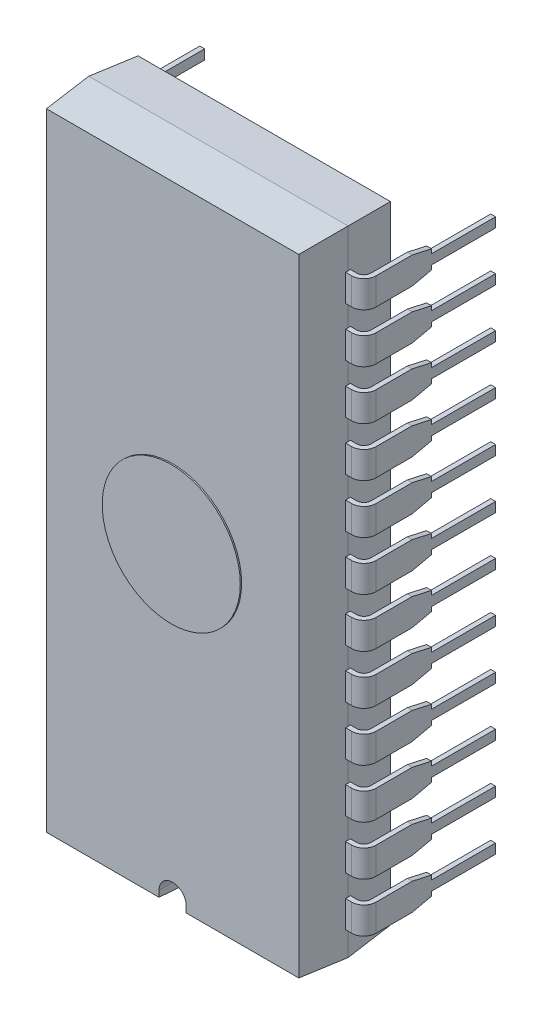
from build123d import *

# Parameters (mm, degrees)
BASIC_SHAPE_DEPTH               = 16.32
SIDE_PROFILE1_DEPTH             = 19.538694668
SIDE_PROFILE1_DEPTH_BACK        = 19.538694668
SIDE_PROFILE2_DEPTH             = 19.538694668
SIDE_PROFILE2_DEPTH_BACK        = 19.538694668
SKETCH6_W                       = 0.25
SKETCH6_H                       = 1.39
PIN_RELIEF_DEPTH                = 23.280195331
REMAINING_PINS_COUNT            = 12
REMAINING_PINS_PITCH            = 2.54
REMAINING_PINS_COPY_1_SKETCH_W  = 0.25
REMAINING_PINS_COPY_1_SKETCH_H  = 1.39
REMAINING_PINS_COPY_2_SKETCH_W  = 0.25
REMAINING_PINS_COPY_2_SKETCH_H  = 1.39
REMAINING_PINS_COPY_3_SKETCH_W  = 0.25
REMAINING_PINS_COPY_3_SKETCH_H  = 1.39
REMAINING_PINS_COPY_4_SKETCH_W  = 0.25
REMAINING_PINS_COPY_4_SKETCH_H  = 1.39
REMAINING_PINS_COPY_5_SKETCH_W  = 0.25
REMAINING_PINS_COPY_5_SKETCH_H  = 1.39
REMAINING_PINS_COPY_6_SKETCH_W  = 0.25
REMAINING_PINS_COPY_6_SKETCH_H  = 1.39
REMAINING_PINS_COPY_7_SKETCH_W  = 0.25
REMAINING_PINS_COPY_7_SKETCH_H  = 1.39
REMAINING_PINS_COPY_8_SKETCH_W  = 0.25
REMAINING_PINS_COPY_8_SKETCH_H  = 1.39
REMAINING_PINS_COPY_9_SKETCH_W  = 0.25
REMAINING_PINS_COPY_9_SKETCH_H  = 1.39
REMAINING_PINS_COPY_10_SKETCH_W = 0.25
REMAINING_PINS_COPY_10_SKETCH_H = 1.39
REMAINING_PINS_COPY_11_SKETCH_W = 0.25
REMAINING_PINS_COPY_11_SKETCH_H = 1.39
REMAINING_PINS_COPY_12_DEPTH    = 23.280195331
REMAINING_PINS_COPY_13_DEPTH    = 23.280195331
REMAINING_PINS_COPY_14_DEPTH    = 23.280195331
REMAINING_PINS_COPY_15_DEPTH    = 23.280195331
REMAINING_PINS_COPY_16_DEPTH    = 23.280195331
REMAINING_PINS_COPY_17_DEPTH    = 23.280195331
REMAINING_PINS_COPY_18_DEPTH    = 23.280195331
REMAINING_PINS_COPY_19_DEPTH    = 23.280195331
REMAINING_PINS_COPY_20_DEPTH    = 23.280195331
REMAINING_PINS_COPY_21_DEPTH    = 23.280195331
REMAINING_PINS_COPY_22_DEPTH    = 23.280195331
BOSS_EXTRUDE1_START             = 5.72
BOSS_EXTRUDE1_OUTLINE_R         = 3.556
BOSS_EXTRUDE1_DEPTH             = 0.07
LOCATION_MARK_DEPTH             = 21.142907536


with BuildPart() as part:
    # Sketch1 → Basic Shape (new, symmetric)
    with BuildSketch(Plane(origin=(0, 0, 0), x_dir=(1, 0, 0), z_dir=(0, 1, 0))):
        Polygon((-6.5, -5.72), (-6.68, -3.36), (-6.5, -1), (6.5, -1), (6.68, -3.36), (6.5, -5.72), align=None)
    extrude(amount=BASIC_SHAPE_DEPTH, both=True)

    # Sketch2 → Side Profile1 (cut, two sides: drawn at the far end of the back side and taken through both)
    with BuildSketch(Plane(origin=(0, 0, 0), x_dir=(0, 0, -1), z_dir=(1, 0, 0)).offset(-SIDE_PROFILE1_DEPTH_BACK)):
        Polygon((-1, 16.32), (-1, 16.14), (-3.36, 16.32), align=None)
        Polygon((-1, -16.32), (-3.36, -16.32), (-1, -16.14), align=None)
    extrude(amount=SIDE_PROFILE1_DEPTH + SIDE_PROFILE1_DEPTH_BACK, mode=Mode.SUBTRACT)

    # Sketch3 → Side Profile2 (cut, two sides: drawn at the far end of the back side and taken through both)
    with BuildSketch(Plane(origin=(0, 0, 0), x_dir=(0, 0, -1), z_dir=(1, 0, 0)).offset(-SIDE_PROFILE2_DEPTH_BACK)):
        Polygon((-3.36, 16.32), (-5.72, 16.32), (-5.72, 16.14), align=None)
        Polygon((-3.36, -16.32), (-5.72, -16.32), (-5.72, -16.14), align=None)
    extrude(amount=SIDE_PROFILE2_DEPTH + SIDE_PROFILE2_DEPTH_BACK, mode=Mode.SUBTRACT)

    # First Pin: sweep along a path in Sketch5
    with BuildLine(Plane(origin=(0, -14.32, 0), x_dir=(1, 0, 0), z_dir=(0, 1, 0))) as first_pin_path:
        Line((0, -3.36), (6.993, -3.36))
        ThreePointArc((6.993, -3.36), (7.346553391, -3.213553391), (7.493, -2.86))
        Line((7.493, -2.86), (7.493, 3.3))
    # Sketch6 → First Pin (sweep)
    with BuildSketch(Plane(origin=(0, 0, 0), x_dir=(0, 0, -1), z_dir=(1, 0, 0))):
        with Locations((-3.36, -14.32)):
            Rectangle(SKETCH6_W, SKETCH6_H)
    first_pin = sweep(path=first_pin_path.line)

    # Sketch7 → Pin Relief (cut, through all)
    with BuildSketch(Plane.ZY.offset(-7.368)):
        Polygon((-3.3, -14.57), (0, -14.57), (0, -14.7925), (1, -15.015), (-3.3, -15.015), align=None)
        Polygon((-3.3, -14.07), (0, -14.07), (0, -13.8475), (1, -13.625), (-3.3, -13.625), align=None)
    pin_relief = extrude(amount=-PIN_RELIEF_DEPTH, mode=Mode.SUBTRACT)

    # Opp Pin: First Pin, Pin Relief across plane
    add(first_pin.mirror(Plane(origin=(0, 0, 0), x_dir=(0, 0, 1), z_dir=(1, 0, 0))))
    add(pin_relief.mirror(Plane(origin=(0, 0, 0), x_dir=(0, 0, 1), z_dir=(1, 0, 0))), mode=Mode.SUBTRACT)

    # Remaining Pins: First Pin, Pin Relief ×12
    with Locations(*[(0, i * REMAINING_PINS_PITCH, 0) for i in range(1, REMAINING_PINS_COUNT)]):
        add(first_pin)
        add(pin_relief, mode=Mode.SUBTRACT)

    # Remaining Pins copy 1: sweep along a path in Remaining Pins copy 1 path
    with BuildLine(Plane(origin=(0, -11.78, 0), x_dir=(-1, 0, 0), z_dir=(0, 1, 0))) as remaining_pins_copy_1_path:
        Line((0, 3.36), (6.993, 3.36))
        ThreePointArc((6.993, 3.36), (7.346553391, 3.213553391), (7.493, 2.86))
        Line((7.493, 2.86), (7.493, -3.3))
    # Remaining Pins copy 1 sketch → Remaining Pins copy 1 (sweep)
    with BuildSketch(Plane(origin=(0, 2.54, 0), x_dir=(0, 0, -1), z_dir=(-1, 0, 0))):
        with Locations((-3.36, 14.32)):
            Rectangle(REMAINING_PINS_COPY_1_SKETCH_W, REMAINING_PINS_COPY_1_SKETCH_H)
    sweep(path=remaining_pins_copy_1_path.line)

    # Remaining Pins copy 2: sweep along a path in Remaining Pins copy 2 path
    with BuildLine(Plane(origin=(0, -9.24, 0), x_dir=(-1, 0, 0), z_dir=(0, 1, 0))) as remaining_pins_copy_2_path:
        Line((0, 3.36), (6.993, 3.36))
        ThreePointArc((6.993, 3.36), (7.346553391, 3.213553391), (7.493, 2.86))
        Line((7.493, 2.86), (7.493, -3.3))
    # Remaining Pins copy 2 sketch → Remaining Pins copy 2 (sweep)
    with BuildSketch(Plane(origin=(0, 5.08, 0), x_dir=(0, 0, -1), z_dir=(-1, 0, 0))):
        with Locations((-3.36, 14.32)):
            Rectangle(REMAINING_PINS_COPY_2_SKETCH_W, REMAINING_PINS_COPY_2_SKETCH_H)
    sweep(path=remaining_pins_copy_2_path.line)

    # Remaining Pins copy 3: sweep along a path in Remaining Pins copy 3 path
    with BuildLine(Plane(origin=(0, -6.7, 0), x_dir=(-1, 0, 0), z_dir=(0, 1, 0))) as remaining_pins_copy_3_path:
        Line((0, 3.36), (6.993, 3.36))
        ThreePointArc((6.993, 3.36), (7.346553391, 3.213553391), (7.493, 2.86))
        Line((7.493, 2.86), (7.493, -3.3))
    # Remaining Pins copy 3 sketch → Remaining Pins copy 3 (sweep)
    with BuildSketch(Plane(origin=(0, 7.62, 0), x_dir=(0, 0, -1), z_dir=(-1, 0, 0))):
        with Locations((-3.36, 14.32)):
            Rectangle(REMAINING_PINS_COPY_3_SKETCH_W, REMAINING_PINS_COPY_3_SKETCH_H)
    sweep(path=remaining_pins_copy_3_path.line)

    # Remaining Pins copy 4: sweep along a path in Remaining Pins copy 4 path
    with BuildLine(Plane(origin=(0, -4.16, 0), x_dir=(-1, 0, 0), z_dir=(0, 1, 0))) as remaining_pins_copy_4_path:
        Line((0, 3.36), (6.993, 3.36))
        ThreePointArc((6.993, 3.36), (7.346553391, 3.213553391), (7.493, 2.86))
        Line((7.493, 2.86), (7.493, -3.3))
    # Remaining Pins copy 4 sketch → Remaining Pins copy 4 (sweep)
    with BuildSketch(Plane(origin=(0, 10.16, 0), x_dir=(0, 0, -1), z_dir=(-1, 0, 0))):
        with Locations((-3.36, 14.32)):
            Rectangle(REMAINING_PINS_COPY_4_SKETCH_W, REMAINING_PINS_COPY_4_SKETCH_H)
    sweep(path=remaining_pins_copy_4_path.line)

    # Remaining Pins copy 5: sweep along a path in Remaining Pins copy 5 path
    with BuildLine(Plane(origin=(0, -1.62, 0), x_dir=(-1, 0, 0), z_dir=(0, 1, 0))) as remaining_pins_copy_5_path:
        Line((0, 3.36), (6.993, 3.36))
        ThreePointArc((6.993, 3.36), (7.346553391, 3.213553391), (7.493, 2.86))
        Line((7.493, 2.86), (7.493, -3.3))
    # Remaining Pins copy 5 sketch → Remaining Pins copy 5 (sweep)
    with BuildSketch(Plane(origin=(0, 12.7, 0), x_dir=(0, 0, -1), z_dir=(-1, 0, 0))):
        with Locations((-3.36, 14.32)):
            Rectangle(REMAINING_PINS_COPY_5_SKETCH_W, REMAINING_PINS_COPY_5_SKETCH_H)
    sweep(path=remaining_pins_copy_5_path.line)

    # Remaining Pins copy 6: sweep along a path in Remaining Pins copy 6 path
    with BuildLine(Plane(origin=(0, 0.92, 0), x_dir=(-1, 0, 0), z_dir=(0, 1, 0))) as remaining_pins_copy_6_path:
        Line((0, 3.36), (6.993, 3.36))
        ThreePointArc((6.993, 3.36), (7.346553391, 3.213553391), (7.493, 2.86))
        Line((7.493, 2.86), (7.493, -3.3))
    # Remaining Pins copy 6 sketch → Remaining Pins copy 6 (sweep)
    with BuildSketch(Plane(origin=(0, 15.24, 0), x_dir=(0, 0, -1), z_dir=(-1, 0, 0))):
        with Locations((-3.36, 14.32)):
            Rectangle(REMAINING_PINS_COPY_6_SKETCH_W, REMAINING_PINS_COPY_6_SKETCH_H)
    sweep(path=remaining_pins_copy_6_path.line)

    # Remaining Pins copy 7: sweep along a path in Remaining Pins copy 7 path
    with BuildLine(Plane(origin=(0, 3.46, 0), x_dir=(-1, 0, 0), z_dir=(0, 1, 0))) as remaining_pins_copy_7_path:
        Line((0, 3.36), (6.993, 3.36))
        ThreePointArc((6.993, 3.36), (7.346553391, 3.213553391), (7.493, 2.86))
        Line((7.493, 2.86), (7.493, -3.3))
    # Remaining Pins copy 7 sketch → Remaining Pins copy 7 (sweep)
    with BuildSketch(Plane(origin=(0, 17.78, 0), x_dir=(0, 0, -1), z_dir=(-1, 0, 0))):
        with Locations((-3.36, 14.32)):
            Rectangle(REMAINING_PINS_COPY_7_SKETCH_W, REMAINING_PINS_COPY_7_SKETCH_H)
    sweep(path=remaining_pins_copy_7_path.line)

    # Remaining Pins copy 8: sweep along a path in Remaining Pins copy 8 path
    with BuildLine(Plane(origin=(0, 6, 0), x_dir=(-1, 0, 0), z_dir=(0, 1, 0))) as remaining_pins_copy_8_path:
        Line((0, 3.36), (6.993, 3.36))
        ThreePointArc((6.993, 3.36), (7.346553391, 3.213553391), (7.493, 2.86))
        Line((7.493, 2.86), (7.493, -3.3))
    # Remaining Pins copy 8 sketch → Remaining Pins copy 8 (sweep)
    with BuildSketch(Plane(origin=(0, 20.32, 0), x_dir=(0, 0, -1), z_dir=(-1, 0, 0))):
        with Locations((-3.36, 14.32)):
            Rectangle(REMAINING_PINS_COPY_8_SKETCH_W, REMAINING_PINS_COPY_8_SKETCH_H)
    sweep(path=remaining_pins_copy_8_path.line)

    # Remaining Pins copy 9: sweep along a path in Remaining Pins copy 9 path
    with BuildLine(Plane(origin=(0, 8.54, 0), x_dir=(-1, 0, 0), z_dir=(0, 1, 0))) as remaining_pins_copy_9_path:
        Line((0, 3.36), (6.993, 3.36))
        ThreePointArc((6.993, 3.36), (7.346553391, 3.213553391), (7.493, 2.86))
        Line((7.493, 2.86), (7.493, -3.3))
    # Remaining Pins copy 9 sketch → Remaining Pins copy 9 (sweep)
    with BuildSketch(Plane(origin=(0, 22.86, 0), x_dir=(0, 0, -1), z_dir=(-1, 0, 0))):
        with Locations((-3.36, 14.32)):
            Rectangle(REMAINING_PINS_COPY_9_SKETCH_W, REMAINING_PINS_COPY_9_SKETCH_H)
    sweep(path=remaining_pins_copy_9_path.line)

    # Remaining Pins copy 10: sweep along a path in Remaining Pins copy 10 path
    with BuildLine(Plane(origin=(0, 11.08, 0), x_dir=(-1, 0, 0), z_dir=(0, 1, 0))) as remaining_pins_copy_10_path:
        Line((0, 3.36), (6.993, 3.36))
        ThreePointArc((6.993, 3.36), (7.346553391, 3.213553391), (7.493, 2.86))
        Line((7.493, 2.86), (7.493, -3.3))
    # Remaining Pins copy 10 sketch → Remaining Pins copy 10 (sweep)
    with BuildSketch(Plane(origin=(0, 25.4, 0), x_dir=(0, 0, -1), z_dir=(-1, 0, 0))):
        with Locations((-3.36, 14.32)):
            Rectangle(REMAINING_PINS_COPY_10_SKETCH_W, REMAINING_PINS_COPY_10_SKETCH_H)
    sweep(path=remaining_pins_copy_10_path.line)

    # Remaining Pins copy 11: sweep along a path in Remaining Pins copy 11 path
    with BuildLine(Plane(origin=(0, 13.62, 0), x_dir=(-1, 0, 0), z_dir=(0, 1, 0))) as remaining_pins_copy_11_path:
        Line((0, 3.36), (6.993, 3.36))
        ThreePointArc((6.993, 3.36), (7.346553391, 3.213553391), (7.493, 2.86))
        Line((7.493, 2.86), (7.493, -3.3))
    # Remaining Pins copy 11 sketch → Remaining Pins copy 11 (sweep)
    with BuildSketch(Plane(origin=(0, 27.94, 0), x_dir=(0, 0, -1), z_dir=(-1, 0, 0))):
        with Locations((-3.36, 14.32)):
            Rectangle(REMAINING_PINS_COPY_11_SKETCH_W, REMAINING_PINS_COPY_11_SKETCH_H)
    sweep(path=remaining_pins_copy_11_path.line)

    # Remaining Pins copy 12 sketch → Remaining Pins copy 12 (cut, through all)
    with BuildSketch(Plane(origin=(-7.368, 2.54, 0), x_dir=(0, 0, 1), z_dir=(1, 0, 0))):
        Polygon((-3.3, 14.57), (0, 14.57), (0, 14.7925), (1, 15.015), (-3.3, 15.015), align=None)
        Polygon((-3.3, 14.07), (0, 14.07), (0, 13.8475), (1, 13.625), (-3.3, 13.625), align=None)
    extrude(amount=-REMAINING_PINS_COPY_12_DEPTH, mode=Mode.SUBTRACT)

    # Remaining Pins copy 13 sketch → Remaining Pins copy 13 (cut, through all)
    with BuildSketch(Plane(origin=(-7.368, 5.08, 0), x_dir=(0, 0, 1), z_dir=(1, 0, 0))):
        Polygon((-3.3, 14.57), (0, 14.57), (0, 14.7925), (1, 15.015), (-3.3, 15.015), align=None)
        Polygon((-3.3, 14.07), (0, 14.07), (0, 13.8475), (1, 13.625), (-3.3, 13.625), align=None)
    extrude(amount=-REMAINING_PINS_COPY_13_DEPTH, mode=Mode.SUBTRACT)

    # Remaining Pins copy 14 sketch → Remaining Pins copy 14 (cut, through all)
    with BuildSketch(Plane(origin=(-7.368, 7.62, 0), x_dir=(0, 0, 1), z_dir=(1, 0, 0))):
        Polygon((-3.3, 14.57), (0, 14.57), (0, 14.7925), (1, 15.015), (-3.3, 15.015), align=None)
        Polygon((-3.3, 14.07), (0, 14.07), (0, 13.8475), (1, 13.625), (-3.3, 13.625), align=None)
    extrude(amount=-REMAINING_PINS_COPY_14_DEPTH, mode=Mode.SUBTRACT)

    # Remaining Pins copy 15 sketch → Remaining Pins copy 15 (cut, through all)
    with BuildSketch(Plane(origin=(-7.368, 10.16, 0), x_dir=(0, 0, 1), z_dir=(1, 0, 0))):
        Polygon((-3.3, 14.57), (0, 14.57), (0, 14.7925), (1, 15.015), (-3.3, 15.015), align=None)
        Polygon((-3.3, 14.07), (0, 14.07), (0, 13.8475), (1, 13.625), (-3.3, 13.625), align=None)
    extrude(amount=-REMAINING_PINS_COPY_15_DEPTH, mode=Mode.SUBTRACT)

    # Remaining Pins copy 16 sketch → Remaining Pins copy 16 (cut, through all)
    with BuildSketch(Plane(origin=(-7.368, 12.7, 0), x_dir=(0, 0, 1), z_dir=(1, 0, 0))):
        Polygon((-3.3, 14.57), (0, 14.57), (0, 14.7925), (1, 15.015), (-3.3, 15.015), align=None)
        Polygon((-3.3, 14.07), (0, 14.07), (0, 13.8475), (1, 13.625), (-3.3, 13.625), align=None)
    extrude(amount=-REMAINING_PINS_COPY_16_DEPTH, mode=Mode.SUBTRACT)

    # Remaining Pins copy 17 sketch → Remaining Pins copy 17 (cut, through all)
    with BuildSketch(Plane(origin=(-7.368, 15.24, 0), x_dir=(0, 0, 1), z_dir=(1, 0, 0))):
        Polygon((-3.3, 14.57), (0, 14.57), (0, 14.7925), (1, 15.015), (-3.3, 15.015), align=None)
        Polygon((-3.3, 14.07), (0, 14.07), (0, 13.8475), (1, 13.625), (-3.3, 13.625), align=None)
    extrude(amount=-REMAINING_PINS_COPY_17_DEPTH, mode=Mode.SUBTRACT)

    # Remaining Pins copy 18 sketch → Remaining Pins copy 18 (cut, through all)
    with BuildSketch(Plane(origin=(-7.368, 17.78, 0), x_dir=(0, 0, 1), z_dir=(1, 0, 0))):
        Polygon((-3.3, 14.57), (0, 14.57), (0, 14.7925), (1, 15.015), (-3.3, 15.015), align=None)
        Polygon((-3.3, 14.07), (0, 14.07), (0, 13.8475), (1, 13.625), (-3.3, 13.625), align=None)
    extrude(amount=-REMAINING_PINS_COPY_18_DEPTH, mode=Mode.SUBTRACT)

    # Remaining Pins copy 19 sketch → Remaining Pins copy 19 (cut, through all)
    with BuildSketch(Plane(origin=(-7.368, 20.32, 0), x_dir=(0, 0, 1), z_dir=(1, 0, 0))):
        Polygon((-3.3, 14.57), (0, 14.57), (0, 14.7925), (1, 15.015), (-3.3, 15.015), align=None)
        Polygon((-3.3, 14.07), (0, 14.07), (0, 13.8475), (1, 13.625), (-3.3, 13.625), align=None)
    extrude(amount=-REMAINING_PINS_COPY_19_DEPTH, mode=Mode.SUBTRACT)

    # Remaining Pins copy 20 sketch → Remaining Pins copy 20 (cut, through all)
    with BuildSketch(Plane(origin=(-7.368, 22.86, 0), x_dir=(0, 0, 1), z_dir=(1, 0, 0))):
        Polygon((-3.3, 14.57), (0, 14.57), (0, 14.7925), (1, 15.015), (-3.3, 15.015), align=None)
        Polygon((-3.3, 14.07), (0, 14.07), (0, 13.8475), (1, 13.625), (-3.3, 13.625), align=None)
    extrude(amount=-REMAINING_PINS_COPY_20_DEPTH, mode=Mode.SUBTRACT)

    # Remaining Pins copy 21 sketch → Remaining Pins copy 21 (cut, through all)
    with BuildSketch(Plane(origin=(-7.368, 25.4, 0), x_dir=(0, 0, 1), z_dir=(1, 0, 0))):
        Polygon((-3.3, 14.57), (0, 14.57), (0, 14.7925), (1, 15.015), (-3.3, 15.015), align=None)
        Polygon((-3.3, 14.07), (0, 14.07), (0, 13.8475), (1, 13.625), (-3.3, 13.625), align=None)
    extrude(amount=-REMAINING_PINS_COPY_21_DEPTH, mode=Mode.SUBTRACT)

    # Remaining Pins copy 22 sketch → Remaining Pins copy 22 (cut, through all)
    with BuildSketch(Plane(origin=(-7.368, 27.94, 0), x_dir=(0, 0, 1), z_dir=(1, 0, 0))):
        Polygon((-3.3, 14.57), (0, 14.57), (0, 14.7925), (1, 15.015), (-3.3, 15.015), align=None)
        Polygon((-3.3, 14.07), (0, 14.07), (0, 13.8475), (1, 13.625), (-3.3, 13.625), align=None)
    extrude(amount=-REMAINING_PINS_COPY_22_DEPTH, mode=Mode.SUBTRACT)

    # Boss-Extrude1: read off the stored shape, not the designer's step
    # Boss-Extrude1 outline → Boss-Extrude1 (add)
    with BuildSketch(Plane.XY.offset(BOSS_EXTRUDE1_START)):
        Circle(BOSS_EXTRUDE1_OUTLINE_R)
    extrude(amount=BOSS_EXTRUDE1_DEPTH)

    # Sketch4 → Location Mark (cut, through all)
    with BuildSketch(Plane.XY.offset(5.72)):
        with BuildLine():
            Line((-0.7, -16.32), (-0.7, -15.82))
            ThreePointArc((-0.7, -15.82), (0, -15.12), (0.7, -15.82))
            Line((0.7, -15.82), (0.7, -16.32))
            Line((0.7, -16.32), (-0.7, -16.32))
        make_face()
    extrude(amount=-LOCATION_MARK_DEPTH, mode=Mode.SUBTRACT)


solid = part.part
